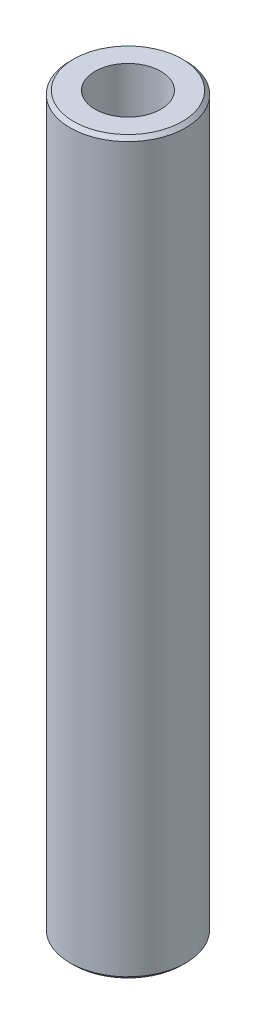
from build123d import *

# Parameters (mm, degrees)
SKETCH1_R           = 47.5
BOSS_EXTRUDE1_DEPTH = 600
SKETCH2_R           = 27.022813601
CUT_EXTRUDE1_DEPTH  = 604.748706003
CHAMFER1_SIZE       = 2.95437708


with BuildPart() as part:
    # Sketch1 → Boss-Extrude1 (new body)
    with BuildSketch(Plane(origin=(0, 0, 0), x_dir=(1, 0, 0), z_dir=(0, 1, 0))):
        Circle(SKETCH1_R)
    extrude(amount=BOSS_EXTRUDE1_DEPTH)

    # Sketch2 → Cut-Extrude1 (cut, through all)
    with BuildSketch(Plane(origin=(0, 0, 0), x_dir=(1, 0, 0), z_dir=(0, 1, 0))):
        Circle(SKETCH2_R)
    extrude(amount=CUT_EXTRUDE1_DEPTH, mode=Mode.SUBTRACT)

    # Chamfer1
    chamfer1_edges = [part.edges().sort_by_distance(p)[0] for p in [
        (-47.5, 600, 0),
        (-47.5, 0, 0),
    ]]
    chamfer(chamfer1_edges, length=CHAMFER1_SIZE)


solid = part.part
